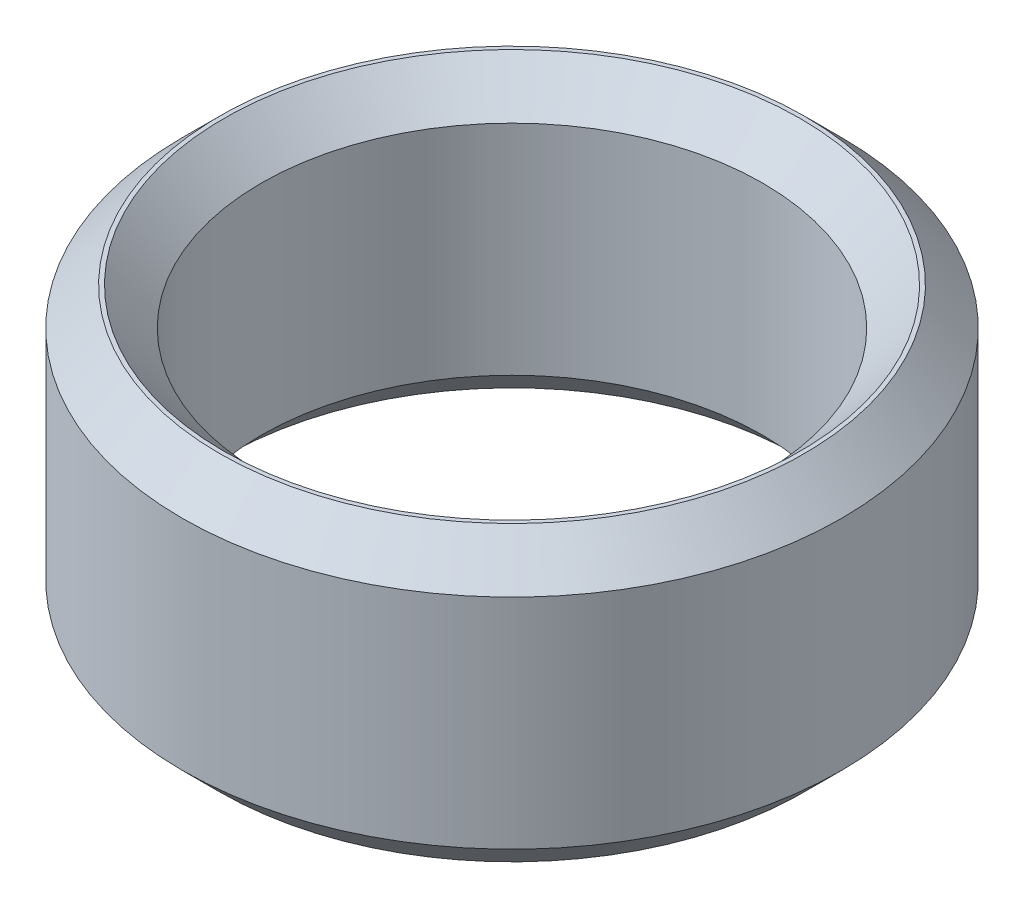
from build123d import *

# Parameters (mm, degrees)
SKETCH1_R           = 12.5
BOSS_EXTRUDE1_DEPTH = 11.10930712
SKETCH2_R           = 9.510238108
CUT_EXTRUDE1_DEPTH  = 21.878618361
CHAMFER1_SIZE       = 1.416152342


with BuildPart() as part:
    # Sketch1 → Boss-Extrude1 (new body)
    with BuildSketch(Plane(origin=(0, 0, 0), x_dir=(1, 0, 0), z_dir=(0, 1, 0))):
        Circle(SKETCH1_R)
    extrude(amount=BOSS_EXTRUDE1_DEPTH)

    # Sketch2 → Cut-Extrude1 (cut, through all)
    with BuildSketch(Plane(origin=(0, 0, 0), x_dir=(1, 0, 0), z_dir=(0, 1, 0))):
        Circle(SKETCH2_R)
    extrude(amount=CUT_EXTRUDE1_DEPTH, mode=Mode.SUBTRACT)

    # Chamfer1
    chamfer1_edges = [part.edges().sort_by_distance(p)[0] for p in [
        (-9.510238108, 11.10930712, 0),
        (-9.510238108, 0, 0),
        (-12.5, 0, 0),
        (-12.5, 11.10930712, 0),
    ]]
    chamfer(chamfer1_edges, length=CHAMFER1_SIZE)


solid = part.part
